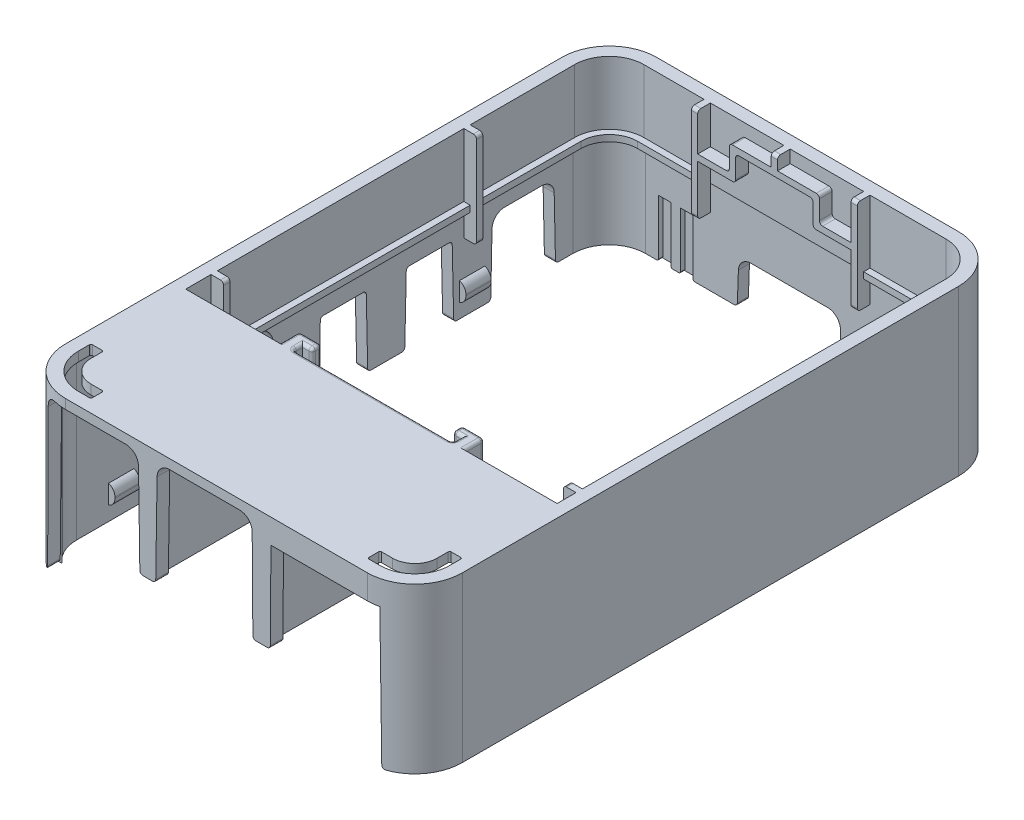
from build123d import *
from build123d.topology import SkipClean

# Parameters (mm, degrees)
ESQUISSE1_W                    = 62.75
ESQUISSE1_H                    = 93.5
CONTOUR_DE_MATIERE_DEPTH       = 26
ARRONDISSEMENT_DES_COINS_R     = 7.5
CREUSAGE_DU_TROU_CENTRAL_REACH = 64.016
REBORD_INTERIEUX_START         = 1
REBORD_INTERIEUX_DEPTH         = 1
ESQUISSE5_W                    = 4
ESQUISSE5_H                    = 1
ESQUISSE5_W_2                  = 1
ESQUISSE5_H_2                  = 4
REBORD_VERTICAUX_DEPTH         = 15
ESQUISSE6_W                    = 24.25
ESQUISSE6_H                    = 1
TROU_DE_DETAIL_DEPTH           = 1
ESQUISSE7_W                    = 5
ESQUISSE7_H                    = 1
ESQUISSE7_W_2                  = 1
ESQUISSE7_H_2                  = 3
ESQUISSE7_W_3                  = 5.625
ESQUISSE7_H_3                  = 2
FANCY_TRUC_DEVANT_DEPTH        = 2
TROU_DE_DESSOUS_DEPTH          = 24.5
EXTRUSION_DE_FILS_DEPTH        = 4.5
ESQUISSE10_W                   = 58.75
ESQUISSE10_H                   = 0.75
REBORD_CONTOUR_TOP_DEPTH       = 1
ESQUISSE11_W                   = 0.75
ESQUISSE11_H                   = 9.5
CONNEXION_UN_COTE_DEPTH        = 1
ENL_V_MAT_EXTRU_1_REACH        = 60.266
ENL_V_MAT_EXTRU_2_REACH        = 63.402
ENL_V_START                    = -24.5
ENL_V_MAT_EXTRU_3_DEPTH        = 24.5
ENL_V_START_2                  = -22.15
ENL_V_MAT_EXTRU_4_DEPTH        = 22.15
BOSS_EXTRU_1_DEPTH             = 2
ESQUISSE18_W                   = 1
ESQUISSE18_H                   = 16
BOSS_EXTRU_2_DEPTH             = 16.5
ESQUISSE22_W                   = 1
ESQUISSE22_H                   = 5.75
BOSS_EXTRU_3_DEPTH             = 3
NERVURE1_REACH                 = 70.477
ESQUISSE24_WALL_W              = 149.21655984
ESQUISSE24_WALL_H              = 1
NERVURE2_REACH                 = 67.617
ESQUISSE25_WALL_W              = 143.495758276
ESQUISSE25_WALL_H              = 1
ENL_V_MAT_EXTRU_5_REACH        = 103.993
ENL_V_MAT_EXTRU_6_REACH        = 84.457
ENL_V_MAT_EXTRU_7_DEPTH        = 3.141101
ENL_V_MAT_EXTRU_9_REACH        = 64.016
CONG_1_R                       = 0.5
ESQUISSE31_W                   = 2
ESQUISSE31_H                   = 0.75
ENL_V_MAT_EXTRU_10_DEPTH       = 9
CONG_2_R                       = 2
CONG_3_R                       = 1
CONG_4_R                       = 3.5
ESQUISSE32_W                   = 4
ESQUISSE32_H                   = 3
BOSS_EXTRU_4_DEPTH             = 1
CONG_5_R                       = 1.5
CONG_5_OF_SYM_TRIE4_R          = 1.5
CONG_6_R                       = 0.25


# Some blends are built 0.0001 mm under size
with BuildPart() as part:
    # Esquisse1 → Contour_de_matiere (new body)
    with BuildSketch(Plane(origin=(0, 0, 0), x_dir=(1, 0, 0), z_dir=(0, 1, 0))):
        Rectangle(ESQUISSE1_W, ESQUISSE1_H)
    extrude(amount=CONTOUR_DE_MATIERE_DEPTH)

    # Arrondissement_des_coins
    arrondissement_des_coins_edges = [part.edges().sort_by_distance(p)[0] for p in [
        (31.375, 13, 46.75),
        (-31.375, 13, 46.75),
        (-31.375, 13, -46.75),
        (31.375, 13, -46.75),
    ]]
    fillet(arrondissement_des_coins_edges, radius=ARRONDISSEMENT_DES_COINS_R)

    # Esquisse2 → Creusage_du_trou_central (cut, up to next)
    with BuildSketch(Plane(origin=(0, 26, 0), x_dir=(1, 0, 0), z_dir=(0, 1, 0)), mode=Mode.PRIVATE) as creusage_du_trou_central_sk1:
        with BuildLine():
            Line((-29.375, -22.25), (29.375, -22.25))
            Line((29.375, -22.25), (29.375, 39.25))
            ThreePointArc((29.375, 39.25), (27.764087297, 43.139087297), (23.875, 44.75))
            Line((23.875, 44.75), (-23.875, 44.75))
            ThreePointArc((-23.875, 44.75), (-27.764087297, 43.139087297), (-29.375, 39.25))
            Line((-29.375, 39.25), (-29.375, -22.25))
        make_face()
    creusage_du_trou_central_tool1 = extrude(creusage_du_trou_central_sk1.sketch, amount=-CREUSAGE_DU_TROU_CENTRAL_REACH, mode=Mode.PRIVATE) & part.part
    add(creusage_du_trou_central_tool1.solids().sort_by_distance((0, 26, -11.143203))[0], mode=Mode.SUBTRACT)

    # Esquisse4 → Rebord_interieux (add)
    with SkipClean():  # the faces are left unmerged after this step: merging them gives an invalid solid
        with BuildSketch(Plane(origin=(0, 15, 0), x_dir=(1, 0, 0), z_dir=(0, 1, 0)).offset(REBORD_INTERIEUX_START)):
            with BuildLine():
                Line((-28.375, -22.25), (-31.375, -22.25))
                Line((-31.375, -22.25), (-31.375, 39.25))
                ThreePointArc((-31.375, 39.25), (-29.178300859, 44.553300859), (-23.875, 46.75))
                Line((-23.875, 46.75), (23.875, 46.75))
                ThreePointArc((23.875, 46.75), (29.178300859, 44.553300859), (31.375, 39.25))
                Line((31.375, 39.25), (31.375, -22.25))
                Line((31.375, -22.25), (28.375, -22.25))
                Line((28.375, -22.25), (28.375, 39.25))
                ThreePointArc((28.375, 39.25), (27.056980515, 42.431980515), (23.875, 43.75))
                Line((23.875, 43.75), (-23.875, 43.75))
                ThreePointArc((-23.875, 43.75), (-27.056980515, 42.431980515), (-28.375, 39.25))
                Line((-28.375, 39.25), (-28.375, -22.25))
            make_face()
        extrude(amount=-REBORD_INTERIEUX_DEPTH)
    add(part.part.scale(1), mode=Mode.REPLACE)  # the faces are merged on a copy

    # Esquisse5 → Rebord_verticaux (add)
    with BuildSketch(Plane(origin=(0, 26, 0), x_dir=(1, 0, 0), z_dir=(0, 1, 0))):
        with Locations((-29.375, -17.75)):
            Rectangle(ESQUISSE5_W, ESQUISSE5_H)
        with Locations((29.375, -18.75)):
            Rectangle(ESQUISSE5_W, ESQUISSE5_H)
        with Locations((11.375, 44.75)):
            Rectangle(ESQUISSE5_W_2, ESQUISSE5_H_2)
        with Locations((-29.375, 22.25)):
            Rectangle(ESQUISSE5_W, ESQUISSE5_H)
        with Locations((-13.875, 44.75)):
            Rectangle(ESQUISSE5_W_2, ESQUISSE5_H_2)
    extrude(amount=-REBORD_VERTICAUX_DEPTH)

    # Esquisse6 → Trou_de_detail (cut)
    with BuildSketch(Plane.XY.offset(-43.75)):
        with Locations((-1.25, 15.5)):
            Rectangle(ESQUISSE6_W, ESQUISSE6_H)
    extrude(amount=-TROU_DE_DETAIL_DEPTH, mode=Mode.SUBTRACT)

    # Esquisse7 → Fancy_truc_devant (add)
    with BuildSketch(Plane.XY.offset(-44.75)):
        with Locations((-10.875, 19.5)):
            Rectangle(ESQUISSE7_W, ESQUISSE7_H)
        with Locations((-7.875, 19.5)):
            Rectangle(ESQUISSE7_W_2, ESQUISSE7_H)
        with Locations((-7.875, 21.5)):
            Rectangle(ESQUISSE7_W_2, ESQUISSE7_H_2)
        with Locations((-7.875, 23.5)):
            Rectangle(ESQUISSE7_W_2, ESQUISSE7_H)
        with Locations((-4.5625, 23.5)):
            Rectangle(ESQUISSE7_W_3, ESQUISSE7_H)
        with Locations((-1.25, 23.5)):
            Rectangle(ESQUISSE7_W_2, ESQUISSE7_H)
        with Locations((-1.25, 25)):
            Rectangle(ESQUISSE7_W_2, ESQUISSE7_H_3)
        with Locations((2.0625, 23.5)):
            Rectangle(ESQUISSE7_W_3, ESQUISSE7_H)
        with Locations((5.375, 23.5)):
            Rectangle(ESQUISSE7_W_2, ESQUISSE7_H)
        with Locations((5.375, 21.5)):
            Rectangle(ESQUISSE7_W_2, ESQUISSE7_H_2)
        with Locations((5.375, 19.5)):
            Rectangle(ESQUISSE7_W_2, ESQUISSE7_H)
        with Locations((8.375, 19.5)):
            Rectangle(ESQUISSE7_W, ESQUISSE7_H)
    extrude(amount=FANCY_TRUC_DEVANT_DEPTH)

    # Esquisse9 → Trou_de_dessous (cut)
    with BuildSketch(Plane.XZ):
        with BuildLine():
            Line((-29.375, 22.25), (-29.375, 39.25))
            ThreePointArc((-29.375, 39.25), (-27.764087297, 43.139087297), (-23.875, 44.75))
            Line((-23.875, 44.75), (23.875, 44.75))
            ThreePointArc((23.875, 44.75), (27.764087297, 43.139087297), (29.375, 39.25))
            Line((29.375, 39.25), (29.375, 22.25))
            Line((29.375, 22.25), (-29.375, 22.25))
        make_face()
    extrude(amount=-TROU_DE_DESSOUS_DEPTH, mode=Mode.SUBTRACT)

    # Esquisse8 → Extrusion_de_fils (add)
    with BuildSketch(Plane(origin=(0, 26, 0), x_dir=(1, 0, 0), z_dir=(0, 1, 0))):
        Polygon((-14.625, -19), (-14.625, -23), (14.625, -23), (14.625, -19), (11.125, -19), (11.125, -20.5), (12.625, -20.5), (12.625, -22), (-12.625, -22), (-12.625, -20.5), (-11.125, -20.5), (-11.125, -19), align=None)
    extrude(amount=-EXTRUSION_DE_FILS_DEPTH)

    # Esquisse10 → Rebord_contour_top (add)
    with BuildSketch(Plane.XZ.offset(-24.5)):
        with Locations((0, 22.625)):
            Rectangle(ESQUISSE10_W, ESQUISSE10_H)
    extrude(amount=REBORD_CONTOUR_TOP_DEPTH)

    # Esquisse11 → Connexion_un_cote (add)
    with BuildSketch(Plane.ZY.offset(-29.375)):
        with Locations((22.625, 19.75)):
            Rectangle(ESQUISSE11_W, ESQUISSE11_H)
    connexion_un_cote = extrude(amount=CONNEXION_UN_COTE_DEPTH)

    # Symetrie_de_connexion: Connexion_un_cote across plane
    add(connexion_un_cote.mirror(Plane(origin=(0, 0, 0), x_dir=(0, 0, 1), z_dir=(1, 0, 0))))

    # Esquisse12 → Enlèv. mat.-Extru.1 (cut, up to next)
    with BuildSketch(Plane(origin=(0, 15, 0), x_dir=(1, 0, 0), z_dir=(0, 1, 0)), mode=Mode.PRIVATE) as enl_v_mat_extru_1_sk1:
        with BuildLine():
            Line((-29.625, -39.25), (-29.625, 39.25))
            ThreePointArc((-29.625, 39.25), (-27.940863992, 43.315863992), (-23.875, 45))
            Line((-23.875, 45), (23.875, 45))
            ThreePointArc((23.875, 45), (27.940863992, 43.315863992), (29.625, 39.25))
            Line((29.625, 39.25), (29.625, -39.25))
            ThreePointArc((29.625, -39.25), (27.940863992, -43.315863992), (23.875, -45))
            Line((23.875, -45), (-23.875, -45))
            ThreePointArc((-23.875, -45), (-27.940863992, -43.315863992), (-29.625, -39.25))
        make_face()
        with BuildLine():
            Line((-29.375, -39.25), (-29.375, 39.25))
            ThreePointArc((-29.375, 39.25), (-27.764087297, 43.139087297), (-23.875, 44.75))
            Line((-23.875, 44.75), (23.875, 44.75))
            ThreePointArc((23.875, 44.75), (27.764087297, 43.139087297), (29.375, 39.25))
            Line((29.375, 39.25), (29.375, -39.25))
            ThreePointArc((29.375, -39.25), (27.764087297, -43.139087297), (23.875, -44.75))
            Line((23.875, -44.75), (-23.875, -44.75))
            ThreePointArc((-23.875, -44.75), (-27.764087297, -43.139087297), (-29.375, -39.25))
        make_face(mode=Mode.SUBTRACT)
    enl_v_mat_extru_1_tool1 = extrude(enl_v_mat_extru_1_sk1.sketch, amount=-ENL_V_MAT_EXTRU_1_REACH, mode=Mode.PRIVATE) & part.part
    add(enl_v_mat_extru_1_tool1.solids().sort_by_distance((-29.517248, 15, 0))[0], mode=Mode.SUBTRACT)

    # Esquisse14 → Enlèv. mat.-Extru.2 (cut, up to next)
    with BuildSketch(Plane.XZ.offset(-24.5), mode=Mode.PRIVATE) as enl_v_mat_extru_2_sk1:
        with BuildLine():
            Line((29.625, 23), (29.625, 39.25))
            ThreePointArc((29.625, 39.25), (27.940863992, 43.315863992), (23.875, 45))
            Line((23.875, 45), (-23.875, 45))
            ThreePointArc((-23.875, 45), (-27.940863992, 43.315863992), (-29.625, 39.25))
            Line((-29.625, 39.25), (-29.625, 23))
            Line((-29.625, 23), (29.625, 23))
        make_face()
    enl_v_mat_extru_2_tool1 = extrude(enl_v_mat_extru_2_sk1.sketch, amount=ENL_V_MAT_EXTRU_2_REACH, mode=Mode.PRIVATE) & part.part
    add(enl_v_mat_extru_2_tool1.solids().sort_by_distance((0, 24.5, 33.893067))[0], mode=Mode.SUBTRACT)

    # Esquisse15 → Enlèv. mat.-Extru.3 (cut)
    with BuildSketch(Plane(origin=(0, 0, 0), x_dir=(-1, 0, 0), z_dir=(0, -1, 0)).offset(ENL_V_START)):
        with BuildLine():
            Line((27.625, -45.745190528), (27.625, -43.608898944))
            ThreePointArc((27.625, -43.608898944), (25.874853879, -44.641018871), (23.875, -45))
            Line((23.875, -45), (-8.125, -45))
            Line((-8.125, -45), (-8.125, -46.75))
            Line((-8.125, -46.75), (23.875, -46.75))
            ThreePointArc((23.875, -46.75), (25.816142838, -46.494443697), (27.625, -45.745190528))
        make_face()
    extrude(amount=ENL_V_MAT_EXTRU_3_DEPTH, mode=Mode.SUBTRACT)

    # Esquisse16 → Enlèv. mat.-Extru.4 (cut)
    with BuildSketch(Plane(origin=(0, 0, 0), x_dir=(-1, 0, 0), z_dir=(0, -1, 0)).offset(ENL_V_START_2)):
        with BuildLine():
            Line((-25.625, -44.727225575), (-25.625, -46.542976073))
            ThreePointArc((-25.625, -46.542976073), (-24.756101428, -46.698064196), (-23.875, -46.75))
            Line((-23.875, -46.75), (-8.125, -46.75))
            Line((-8.125, -46.75), (-8.125, -45))
            Line((-8.125, -45), (-23.875, -45))
            ThreePointArc((-23.875, -45), (-24.760565622, -44.931397146), (-25.625, -44.727225575))
        make_face()
    extrude(amount=ENL_V_MAT_EXTRU_4_DEPTH, mode=Mode.SUBTRACT)

    # Esquisse17 → Boss.-Extru.1 (add)
    with BuildSketch(Plane.XY.offset(46.75)):
        Polygon((-12.375, 24.5), (-12.125, 7.85), (-9.625, 7.85), (-9.375, 24.5), align=None)
        Polygon((5.625, 24.5), (8.625, 24.5), (8.5, 7.85), (5.75, 7.85), align=None)
    extrude(amount=-BOSS_EXTRU_1_DEPTH)

    # Esquisse18 → Boss.-Extru.2 (add)
    with BuildSketch(Plane(origin=(0, 24.5, 0), x_dir=(-1, 0, 0), z_dir=(0, -1, 0))):
        with Locations((10.875, -36.75)):
            Rectangle(ESQUISSE18_W, ESQUISSE18_H)
        with Locations((-7.125, -36.75)):
            Rectangle(ESQUISSE18_W, ESQUISSE18_H)
    extrude(amount=BOSS_EXTRU_2_DEPTH)

    # Esquisse22 → Boss.-Extru.3 (add)
    with BuildSketch(Plane(origin=(0, 24.5, 0), x_dir=(-1, 0, 0), z_dir=(0, -1, 0))):
        with Locations((10.875, -25.875)):
            Rectangle(ESQUISSE22_W, ESQUISSE22_H)
        with Locations((-7.125, -25.875)):
            Rectangle(ESQUISSE22_W, ESQUISSE22_H)
    extrude(amount=BOSS_EXTRU_3_DEPTH)

    # Esquisse24 wall → Nervure1 (add, up to next)
    with BuildSketch(Plane(origin=(-11.375, 17.25, 25.875), x_dir=(0, 0.828283413128, -0.560309367704), z_dir=(0, -0.560309367704, -0.828283413128)), mode=Mode.PRIVATE) as nervure1_sk1:
        with Locations((0, 0.5)):
            Rectangle(ESQUISSE24_WALL_W, ESQUISSE24_WALL_H)
    nervure1_tool1 = extrude(nervure1_sk1.sketch, amount=-NERVURE1_REACH, mode=Mode.PRIVATE) - part.part
    add(nervure1_tool1.solids().sort_by_distance((-11.375, 17.25, 25.875))[0])

    # Esquisse25 wall → Nervure2 (add, up to next)
    with BuildSketch(Plane(origin=(6.625, 17.25, 25.875), x_dir=(0, 0.828283413128, -0.560309367704), z_dir=(0, -0.560309367704, -0.828283413128)), mode=Mode.PRIVATE) as nervure2_sk1:
        with Locations((0, 0.5)):
            Rectangle(ESQUISSE25_WALL_W, ESQUISSE25_WALL_H)
    nervure2_tool1 = extrude(nervure2_sk1.sketch, amount=-NERVURE2_REACH, mode=Mode.PRIVATE) - part.part
    add(nervure2_tool1.solids().sort_by_distance((6.625, 17.25, 25.875))[0])

    # Esquisse27 → Enlèv. mat.-Extru.5 (cut, up to next)
    with BuildSketch(Plane(origin=(0, 0, -46.75), x_dir=(-1, 0, 0), z_dir=(0, 0, -1)), mode=Mode.PRIVATE) as enl_v_mat_extru_5_sk1:
        Polygon((-7.125, 0), (9.375, 0), (9.125, 7), (-6.875, 7), align=None)
    enl_v_mat_extru_5_tool1 = extrude(enl_v_mat_extru_5_sk1.sketch, amount=-ENL_V_MAT_EXTRU_5_REACH, mode=Mode.PRIVATE) & part.part
    add(enl_v_mat_extru_5_tool1.solids().sort_by_distance((-1.125, 3.482051, -46.75))[0], mode=Mode.SUBTRACT)

    # Esquisse28 → Enlèv. mat.-Extru.6 (cut, up to next)
    with BuildSketch(Plane.ZY.offset(31.375), mode=Mode.PRIVATE) as enl_v_mat_extru_6_sk1:
        Polygon((-36.5, 0), (-26.25, 0), (-26.5, 11.75), (-36.25, 11.75), align=None)
    enl_v_mat_extru_6_tool1 = extrude(enl_v_mat_extru_6_sk1.sketch, amount=-ENL_V_MAT_EXTRU_6_REACH, mode=Mode.PRIVATE) & part.part
    # Esquisse28 → Enlèv. mat.-Extru.6 (cut, up to next)
    with BuildSketch(Plane.ZY.offset(31.375), mode=Mode.PRIVATE) as enl_v_mat_extru_6_sk2:
        Polygon((-20.4, 0), (-12.65, 0), (-12.9, 11.25), (-20.15, 11.25), align=None)
    enl_v_mat_extru_6_tool2 = extrude(enl_v_mat_extru_6_sk2.sketch, amount=-ENL_V_MAT_EXTRU_6_REACH, mode=Mode.PRIVATE) & part.part
    # Esquisse28 → Enlèv. mat.-Extru.6 (cut, up to next)
    with BuildSketch(Plane.ZY.offset(31.375), mode=Mode.PRIVATE) as enl_v_mat_extru_6_sk3:
        Polygon((-6.8, 0), (-6.55, 11.25), (0.7, 11.25), (0.95, 0), align=None)
    enl_v_mat_extru_6_tool3 = extrude(enl_v_mat_extru_6_sk3.sketch, amount=-ENL_V_MAT_EXTRU_6_REACH, mode=Mode.PRIVATE) & part.part
    # Esquisse28 → Enlèv. mat.-Extru.6 (cut, up to next)
    with BuildSketch(Plane.ZY.offset(31.375), mode=Mode.PRIVATE) as enl_v_mat_extru_6_sk4:
        with BuildLine():
            Line((7.95, 0), (15.2, 0))
            Line((15.2, 0), (15.075, 11))
            ThreePointArc((15.075, 11), (11.575, 14.5), (8.075, 11))
            Line((8.075, 11), (7.95, 0))
        make_face()
    enl_v_mat_extru_6_tool4 = extrude(enl_v_mat_extru_6_sk4.sketch, amount=-ENL_V_MAT_EXTRU_6_REACH, mode=Mode.PRIVATE) & part.part
    add(enl_v_mat_extru_6_tool1.solids().sort_by_distance((-31.375, 5.826042, -31.375))[0], mode=Mode.SUBTRACT)
    add(enl_v_mat_extru_6_tool2.solids().sort_by_distance((-31.375, 5.5625, -16.525))[0], mode=Mode.SUBTRACT)
    add(enl_v_mat_extru_6_tool3.solids().sort_by_distance((-31.375, 5.5625, -2.925))[0], mode=Mode.SUBTRACT)
    add(enl_v_mat_extru_6_tool4.solids().sort_by_distance((-31.375, 6.851143, 11.575))[0], mode=Mode.SUBTRACT)

    # Esquisse29 → Enlèv. mat.-Extru.7 (cut)
    with BuildSketch(Plane.XY.offset(46.75)):
        Polygon((-27.625, 0), (-27.625, 24.5), (-27.875, 0), align=None)
        Polygon((25.625, 22.15), (25.625, 0), (25.875, 0), align=None)
    extrude(amount=-ENL_V_MAT_EXTRU_7_DEPTH, mode=Mode.SUBTRACT)

    # Esquisse30 → Enlèv. mat.-Extru.9 (cut, up to next)
    with BuildSketch(Plane(origin=(0, 26, 0), x_dir=(1, 0, 0), z_dir=(0, 1, 0)), mode=Mode.PRIVATE) as enl_v_mat_extru_9_sk1:
        with BuildLine():
            Line((-21.875, -44.75), (-21.875, -42.75))
            Line((-21.875, -42.75), (-23.875, -42.75))
            ThreePointArc((-23.875, -42.75), (-26.349873734, -41.724873734), (-27.375, -39.25))
            Line((-27.375, -39.25), (-27.375, -37.25))
            Line((-27.375, -37.25), (-29.375, -37.25))
            Line((-29.375, -37.25), (-29.375, -39.25))
            ThreePointArc((-29.375, -39.25), (-27.764087297, -43.139087297), (-23.875, -44.75))
            Line((-23.875, -44.75), (-21.875, -44.75))
        make_face()
    enl_v_mat_extru_9_tool1 = extrude(enl_v_mat_extru_9_sk1.sketch, amount=-ENL_V_MAT_EXTRU_9_REACH, mode=Mode.PRIVATE) & part.part
    enl_v_mat_extru_9 = enl_v_mat_extru_9_tool1.solids().sort_by_distance((-26.367038, 26, 41.742038))[0]
    add(enl_v_mat_extru_9, mode=Mode.SUBTRACT)

    # Symétrie2: Enlèv. mat.-Extru.9 across plane
    add(enl_v_mat_extru_9.mirror(Plane(origin=(0, 0, 0), x_dir=(0, 0, 1), z_dir=(1, 0, 0))), mode=Mode.SUBTRACT)

    # Congé1
    cong_1_edges = [part.edges().sort_by_distance(p)[0] for p in [
        (-27.375, 26, 17.75),
        (-27.375, 11, 17.75),
        (11.375, 26, -42.75),
        (11.375, 11, -42.75),
        (27.375, 26, 18.75),
        (27.375, 11, 18.75),
        (-27.375, 26, -22.25),
        (-27.375, 11, -22.25),
        (-13.875, 26, -42.75),
        (-13.875, 11, -42.75),
        (-7.375, 19, -43.75),
        (-7.375, 23, -43.75),
        (4.875, 23, -43.75),
        (4.875, 19, -43.75),
        (5.875, 20, -43.75),
        (5.875, 24, -43.75),
        (-8.375, 24, -43.75),
        (-8.375, 20, -43.75),
        (-1.25, 26, -42.75),
        (14.625, 26, 20.625),
        (12.875, 26, 19),
        (11.125, 26, 19.75),
        (11.875, 26, 20.5),
        (12.625, 26, 21.25),
        (0, 26, 22),
        (-12.625, 26, 21.25),
        (-11.875, 26, 20.5),
        (-11.125, 26, 19.75),
        (-12.875, 26, 19),
        (-14.625, 26, 20.625),
        (14.625, 21.5, 21),
        (14.625, 23.75, 19),
        (-13, 21.5, 23),
        (-14.625, 21.5, 21),
        (-12.875, 21.5, 19),
        (-14.625, 23.75, 19),
        (-11.125, 21.5, 19.75),
        (-11.125, 23.75, 19),
        (-11.875, 21.5, 20.5),
        (-11.125, 23.75, 20.5),
        (-12.625, 21.5, 21.25),
        (0, 21.5, 22),
        (-12.625, 23.75, 22),
        (12.625, 21.5, 21.25),
        (12.625, 23.75, 22),
        (11.875, 21.5, 20.5),
        (11.125, 21.5, 19.75),
        (11.125, 23.75, 20.5),
        (12.875, 21.5, 19),
        (11.125, 23.75, 19),
        (-9.625, 7.85, 45.75),
        (-12.125, 7.85, 45.75),
        (8.5, 7.85, 45.75),
        (5.75, 7.85, 45.75),
        (-10.875, 8, 28.75),
        (7.125, 8, 28.75),
        (11.125, 21.5, 23),
        (7.125, 0, -45.875),
        (-9.375, 0, -45.875),
        (-30.5, 0, -36.5),
        (-30.5, 0, -26.25),
        (-30.5, 0, -20.4),
        (-30.5, 11.25, -20.15),
        (-30.5, 11.25, -12.9),
        (-30.5, 0, -12.65),
        (-30.5, 0, 0.95),
        (-30.5, 0, -6.8),
        (-30.5, 11.25, -6.55),
        (-30.5, 11.25, 0.7),
        (-30.5, 0, 7.95),
        (-30.5, 0, 15.2),
        (-27.875, 0, 44.601593885),
        (25.875, 0, 45.559690405),
    ]]
    fillet(cong_1_edges, radius=CONG_1_R - 0.0001)  # a hair under: the kernel refuses the full size

    # Esquisse31 → Enlèv. mat.-Extru.10 (cut)
    with BuildSketch(Plane(origin=(0, 0, 0), x_dir=(-1, 0, 0), z_dir=(0, -1, 0))):
        with Locations((17.357780206, 45.375)):
            Rectangle(ESQUISSE31_W, ESQUISSE31_H)
        with Locations((20.857780206, 45.375)):
            Rectangle(ESQUISSE31_W, ESQUISSE31_H)
    extrude(amount=-ENL_V_MAT_EXTRU_10_DEPTH, mode=Mode.SUBTRACT)

    # Congé2
    # the kernel refuses this fillet: 2 mm, written as the material it adds along each edge
    with BuildSketch(Plane(origin=(6.875, 7, -46.75), x_dir=(-1, 0, 0), z_dir=(0, 0, 1)), Plane(origin=(-9.125, 7, -46.75), x_dir=(-0.035691530512412355, -0.9993628543475497, 0), z_dir=(0, 0, 1))) as cong_2_piece_1:
        with BuildLine():
            CenterArc((CONG_2_R * 0.964923266152, CONG_2_R), CONG_2_R, 182.045408489, 87.954591511)
            Line((-CONG_2_R * 0.034439588196, CONG_2_R * 0.964308469488), (0, 0))
            Line((0, 0), (CONG_2_R * 0.964923266152, 0))
        make_face()
    extrude(amount=1.75)
    with BuildSketch(Plane(origin=(5.625, 24.5, 46.75), x_dir=(-1, 0, 0), z_dir=(0, 0, -1))) as cong_2_piece_2:
        with BuildLine():
            CenterArc((CONG_2_R * 0.99252067343, -CONG_2_R), CONG_2_R, 90, 89.569859586)
            Line((-CONG_2_R * 0.00745114642684, -CONG_2_R * 0.992492704055), (0, 0))
            Line((0, 0), (CONG_2_R * 0.99252067343, 0))
        make_face()
    extrude(amount=2)
    with BuildSketch(Plane(origin=(-9.375, 24.5, 46.75), x_dir=(-0.015013322728512805, -0.9998872937189719, 0), z_dir=(0, 0, -1)), Plane(origin=(-12.375, 24.5, 46.75), x_dir=(-1, 0, 0), z_dir=(0, 0, -1))) as cong_2_piece_3:
        with BuildLine():
            CenterArc((CONG_2_R * 0.98509770397, -CONG_2_R), CONG_2_R, 90, 89.139767653)
            Line((-CONG_2_R * 0.0147895897488, -CONG_2_R * 0.984986677271), (0, 0))
            Line((0, 0), (CONG_2_R * 0.98509770397, 0))
        make_face()
    extrude(amount=2)
    with BuildSketch(Plane(origin=(-27.625, 24.5, 50.694430422), x_dir=(1, 0, 0), z_dir=(0, 0, -1))) as cong_2_piece_4_section:
        with BuildLine():
            CenterArc((CONG_2_R * 0.989847978653, CONG_2_R), CONG_2_R, 180.584630521, 89.415369479)
            Line((-CONG_2_R * 0.0100999637711, CONG_2_R * 0.989796449567), (0, 0))
            Line((0, 0), (CONG_2_R * 0.989847978653, 0))
        make_face()
    cong_2_piece_4 = extrude(amount=12.034771371, mode=Mode.PRIVATE)
    cong_2_piece_4 = cong_2_piece_4 & Plane(origin=(-23.875, 24.216694132, 39.25), x_dir=(0, 0, 1), z_dir=(0, 1, 0)) * Cylinder(7.5, 32, mode=Mode.PRIVATE)
    cong_2_piece_4 = cong_2_piece_4 - Plane(origin=(-23.875, 24.216694132, 39.25), x_dir=(0, 0, 1), z_dir=(0, 1, 0)) * Cylinder(5.75, 32, mode=Mode.PRIVATE)
    add(cong_2_piece_4)
    with BuildSketch(Plane(origin=(-31.375, 11.75, -26.5), x_dir=(0, 0, -1), z_dir=(1, 0, 0)), Plane(origin=(-31.375, 11.75, -36.25), x_dir=(0, -0.999773730057065, -0.02127178149057462), z_dir=(1, 0, 0))) as cong_2_piece_5:
        with BuildLine():
            CenterArc((CONG_2_R * 0.978949725408, -CONG_2_R), CONG_2_R, 90, 88.781124765)
            Line((-CONG_2_R * 0.0208240046491, -CONG_2_R * 0.978728218509), (0, 0))
            Line((0, 0), (CONG_2_R * 0.978949725408, 0))
        make_face()
    extrude(amount=1.75)

    # Congé3
    cong_3_edges = [part.edges().sort_by_distance(p)[0] for p in [
        (29, 15, 23),
        (-29, 15, 23),
        (-28.875, 16, 22.25),
        (28.875, 16, 22.25),
    ]]
    fillet(cong_3_edges, radius=CONG_3_R)

    # Congé4
    cong_4_edges = [part.edges().sort_by_distance(p)[0] for p in [
        (28.375, 23.5, 22.625),
        (-28.375, 23.5, 22.625),
    ]]
    fillet(cong_4_edges, radius=CONG_4_R)

    # Esquisse32 → Boss.-Extru.4 (add)
    with BuildSketch(Plane(origin=(-29.625, 0, 0), x_dir=(0, 0, -1), z_dir=(1, 0, 0))):
        with Locations((23.324768734, 3.75)):
            Rectangle(ESQUISSE32_W, ESQUISSE32_H)
        with Locations((-32.194382744, 3.75)):
            Rectangle(ESQUISSE32_W, ESQUISSE32_H)
    boss_extru_4 = extrude(amount=BOSS_EXTRU_4_DEPTH)

    # Congé5
    # the kernel refuses this fillet: 1.5 mm, written as the material it takes off along each edge
    with BuildSketch(Plane(origin=(-28.625, 5.25, -17.789234828), x_dir=(-1, 0, 0), z_dir=(0, 0, -1)), Plane(origin=(-28.625, 2.25, -28.86030264), x_dir=(-1, 0, 0), z_dir=(0, 0, 1)), Plane(origin=(-28.625, 5.25, 37.72991665), x_dir=(-1, 0, 0), z_dir=(0, 0, -1)), Plane(origin=(-28.625, 2.25, 26.658848838), x_dir=(-1, 0, 0), z_dir=(0, 0, 1))) as cong_5_piece_1:
        with BuildLine():
            CenterArc((1.5, -1.414213562), CONG_5_R, 109.471220634, 70.528779366)
            Line((0, -1.414213562), (-0.03, -1.414213562))
            Line((-0.03, -1.414213562), (-0.03, 0))
            Line((-0.03, 0), (0, 0.03))
            ThreePointArc((0, 0.03), (0.5, 0.03), (0.99, 0.028284271))
            Line((0.99, 0.028284271), (1, 0))
        make_face()
    extrude(amount=11.071067812, mode=Mode.SUBTRACT)

    # Symétrie4: Boss.-Extru.4 across plane
    add(boss_extru_4.mirror(Plane(origin=(0, 0, 0), x_dir=(0, 0, 1), z_dir=(1, 0, 0))))

    # Congé5 of Symétrie4
    # the kernel refuses this fillet: 1.5 mm, written as the material it takes off along each edge
    with BuildSketch(Plane(origin=(28.625, 5.25, -17.789234828), x_dir=(1, 0, 0), z_dir=(0, 0, -1)), Plane(origin=(28.625, 2.25, -28.86030264), x_dir=(1, 0, 0), z_dir=(0, 0, 1)), Plane(origin=(28.625, 5.25, 37.72991665), x_dir=(1, 0, 0), z_dir=(0, 0, -1)), Plane(origin=(28.625, 2.25, 26.658848838), x_dir=(1, 0, 0), z_dir=(0, 0, 1))) as cong_5_of_sym_trie4_piece_1:
        with BuildLine():
            CenterArc((1.5, 1.414213562), CONG_5_OF_SYM_TRIE4_R, 180, 70.528779366)
            Line((0, 1.414213562), (-0.03, 1.414213562))
            Line((-0.03, 1.414213562), (-0.03, 0))
            Line((-0.03, 0), (0, -0.03))
            ThreePointArc((0, -0.03), (0.5, -0.03), (0.99, -0.028284271))
            Line((0.99, -0.028284271), (1, 0))
        make_face()
    extrude(amount=11.071067812, mode=Mode.SUBTRACT)

    # Congé6
    cong_6_edges = [part.edges().sort_by_distance(p)[0] for p in [
        (-16.357780206, 0, -45.375),
        (-18.357780206, 0, -45.375),
        (-19.857780206, 0, -45.375),
        (-21.857780206, 0, -45.375),
        (-21.875, 25.25, 44.75),
        (-29.375, 25.25, 37.25),
        (-27.375, 25.25, 37.25),
        (-21.875, 25.25, 42.75),
        (21.875, 25.25, 44.75),
        (21.875, 25.25, 42.75),
        (27.375, 25.25, 37.25),
        (29.375, 25.25, 37.25),
    ]]
    fillet(cong_6_edges, radius=CONG_6_R)


solid = part.part
